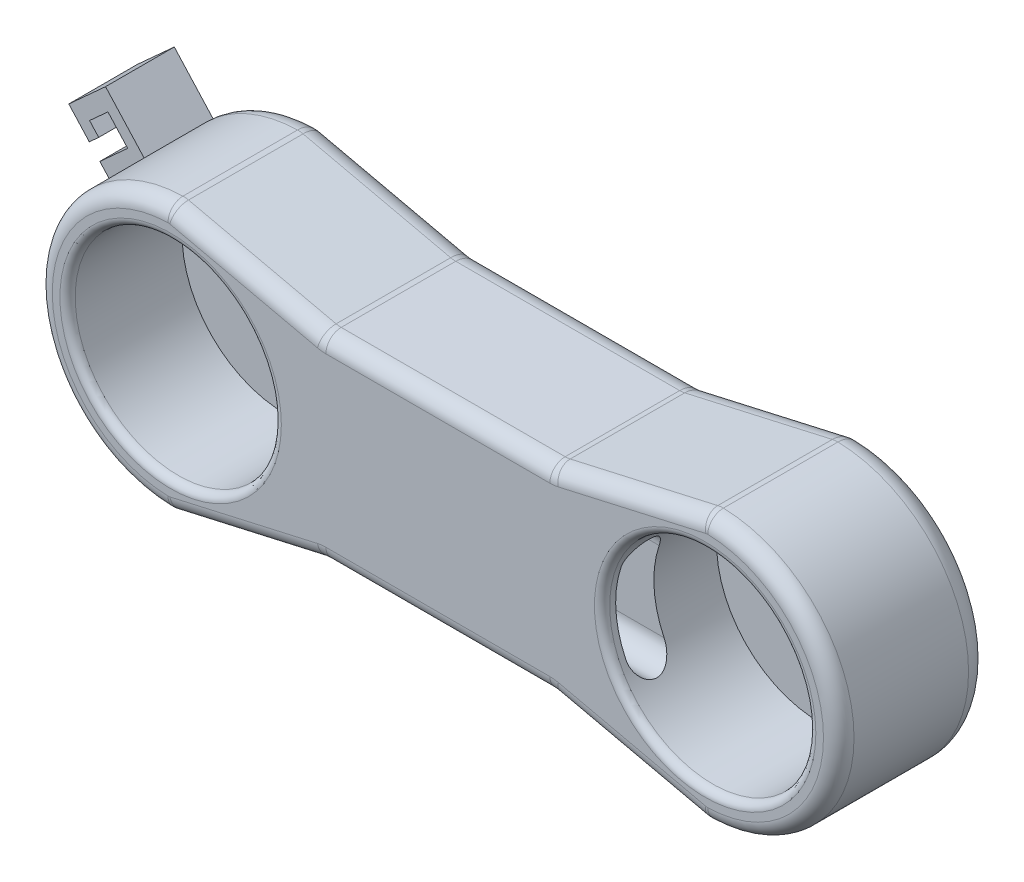
from build123d import *

# Parameters (mm, degrees)
BOSS_EXTRUDE2_DEPTH             = 20
SKETCH12_R                      = 13.5
SKETCH12_R_2                    = 13.500000000000002
CUT_EXTRUDE3_DEPTH              = 15
SKETCH13_R                      = 0.889
SKETCH13_R_2                    = 0.533499999999999
CUT_EXTRUDE4_DEPTH              = 91.48480535426931
SKETCH14_R                      = 0.8890000000000032
SKETCH14_R_2                    = 0.5335000000000029
SKETCH14_R_3                    = 0.5335000000000094
CUT_EXTRUDE5_DEPTH              = 91.48480535426931
FILLET2_R                       = 3
CUT_EXTRUDE8_DEPTH              = 63.00000000000004
FILLET3_R                       = 1
BOSS_EXTRUDE3_REACH             = 107.737
BOSS_EXTRUDE3_END_RADIUS        = 17.500000000000004
SKETCH19_W                      = 9.002102243584886
SKETCH19_H                      = 6.500944555170919
BOSS_EXTRUDE3_DIRECTION_2_DEPTH = 7.5
CUT_EXTRUDE9_DEPTH              = 91.02287753534617
CUT_EXTRUDE9_DEPTH_BACK         = 91.02287753534617
FILLET9_R                       = 2
FILLET11_R                      = 3


with BuildPart() as part:
    # Sketch10 → Boss-Extrude2 (new body)
    with BuildSketch(Plane.XY):
        with BuildLine():
            ThreePointArc((0, 17.500000000000004), (-17.500000000000004, 1.07e-15), (-2.14e-15, -17.500000000000004))
            Line((0, -17.5), (20.000000000000004, -12.967243251438873))
            Line((20.000000000000004, -12.967243251438873), (50, -12.967243251438873))
            Line((50, -12.967243251438873), (70, -17.5))
            ThreePointArc((70, -17.50000000000002), (87.50000000000003, -1.07e-15), (70, 17.50000000000002))
            Line((70, 17.5), (50, 12.967243251438873))
            Line((50, 12.967243251438873), (20.000000000000004, 12.967243251438873))
            Line((20.000000000000004, 12.967243251438873), (0, 17.5))
        make_face()
    extrude(amount=BOSS_EXTRUDE2_DEPTH)

    # Sketch12 → Cut-Extrude3 (cut)
    with BuildSketch(Plane.XY.offset(20)):
        Circle(SKETCH12_R)
        with Locations((70, 0)):
            Circle(SKETCH12_R_2)
    extrude(amount=-CUT_EXTRUDE3_DEPTH, mode=Mode.SUBTRACT)

    # Sketch13 → Cut-Extrude4 (cut, through all)
    with BuildSketch(Plane.XY.offset(5.000000000000001)):
        Circle(SKETCH13_R)
        with Locations((-8.306, 0)):
            Circle(SKETCH13_R_2)
        with Locations(Location((8.306000000000003, 2.03e-15, 0), (0, 0, 180))):
            Circle(SKETCH13_R_2)
    extrude(amount=-CUT_EXTRUDE4_DEPTH, mode=Mode.SUBTRACT)

    # Sketch14 → Cut-Extrude5 (cut, through all)
    with BuildSketch(Plane.XY.offset(5.000000000000001)):
        with Locations((70, 0)):
            Circle(SKETCH14_R)
        with Locations((78.306, -6.5e-16)):
            Circle(SKETCH14_R_2)
        with Locations(Location((61.69400000000001, -2.69e-15, 0), (0, 0, 180))):
            Circle(SKETCH14_R_3)
    extrude(amount=-CUT_EXTRUDE5_DEPTH, mode=Mode.SUBTRACT)

    # Fillet2
    fillet2_edges = [part.edges().sort_by_distance(p)[0] for p in [
        (20.000000000000004, -12.967243251438873, 10),
        (-3.18e-15, -17.5, 10),
        (0, 17.5, 10),
        (20.000000000000004, 12.967243251438873, 10),
        (50, 12.967243251438873, 10),
        (70, 17.500000000000014, 10),
        (70, -17.500000000000014, 10),
        (50, -12.967243251438873, 10),
    ]]
    fillet(fillet2_edges, radius=FILLET2_R)

    # Sketch17 → Cut-Extrude8 (cut)
    with BuildSketch(Plane(origin=(10, 0, 0), x_dir=(0, 0, -1), z_dir=(1, 0, 0))):
        with BuildLine():
            Line((-18.219165985751065, -5.866772091514335), (-18.21916598575106, 4.2723857354989))
            ThreePointArc((-18.21916598575106, 4.2723857354989), (-15.719165985751069, 6.772385735498896), (-13.219165985751072, 4.2723857354989))
            Line((-13.219165985751072, 4.2723857354989), (-13.219165985751069, -5.866772091514335))
            ThreePointArc((-13.219165985751069, -5.866772091514335), (-15.719165985751069, -8.366772091514331), (-18.219165985751065, -5.866772091514335))
        make_face()
    extrude(amount=CUT_EXTRUDE8_DEPTH, mode=Mode.SUBTRACT)

    # Fillet3
    fillet3_edges = [part.edges().sort_by_distance(p)[0] for p in [
        (-13.5, 1.65e-15, 20),
        (56.5, 1.65e-15, 20),
    ]]
    fillet(fillet3_edges, radius=FILLET3_R)

    # Boss-Extrude3: up to this cylinder (the profile starts outside it)
    boss_extrude3_end = Plane(origin=(0, 0, 6.645664), z_dir=(0, 0, -1)) * Cylinder(BOSS_EXTRUDE3_END_RADIUS, 251.474, mode=Mode.PRIVATE)
    # Sketch19 → Boss-Extrude3 (add, up to the surface)
    with BuildSketch(Plane(origin=(-11.761970975540276, 12.9578562567482, 0), x_dir=(0, 0, -1), z_dir=(-0.6721126271737297, 0.7404489289570396, 0)), mode=Mode.PRIVATE) as boss_extrude3_sk1:
        with Locations((-6.645664050040523, 4.026835519852057)):
            Rectangle(SKETCH19_W, SKETCH19_H)
    boss_extrude3_tool1 = extrude(boss_extrude3_sk1.sketch, amount=-BOSS_EXTRUDE3_REACH, mode=Mode.PRIVATE) - boss_extrude3_end
    add(boss_extrude3_tool1.solids().sort_by_distance((-14.743637, 10.251369, 6.645664))[0])

    # Sketch19 → Boss-Extrude3 direction 2 (add)
    with BuildSketch(Plane(origin=(-11.761970975540276, 12.9578562567482, 0), x_dir=(0, 0, -1), z_dir=(-0.6721126271737297, 0.7404489289570396, 0))):
        with Locations((-6.645664050040523, 4.026835519852057)):
            Rectangle(SKETCH19_W, SKETCH19_H)
    extrude(amount=BOSS_EXTRUDE3_DIRECTION_2_DEPTH)

    # Sketch21 → Cut-Extrude9 (cut, two sides: drawn at the far end of the back side and taken through both)
    with BuildSketch(Plane.XY.offset(11.146715171832966).offset(-CUT_EXTRUDE9_DEPTH_BACK)):
        Polygon((-19.508753299581933, 10.664771644994326), (-18.27524674807696, 11.784437426854238), (-19.471024426071118, 13.101794466647876), (-17.06283639674614, 15.287729944193623), (-14.480752862896878, 12.443115946751053), (-18.122447443726838, 9.1375146873454), align=None)
    extrude(amount=CUT_EXTRUDE9_DEPTH + CUT_EXTRUDE9_DEPTH_BACK, mode=Mode.SUBTRACT)

    # Fillet9
    fillet9_edges = [part.edges().sort_by_distance(p)[0] for p in [
        (49.99791778292249, 12.985851092176992, 20),
        (20.00208221707747, 12.985851092176995, 20),
        (87.50000000000003, -1.07e-15, 20),
        (59.99220377741234, -15.231854706692062, 20),
        (35.00000000000002, -12.967243251438873, 20),
        (59.99220377741232, 15.231854706692058, 20),
        (34.99999999999998, 12.967243251438873, 20),
        (10.0077962225877, 15.231854706692053, 20),
        (-17.5, -7e-16, 20),
        (10.007796222587723, -15.231854706692047, 20),
        (-0.01942127728087611, 17.48135942497659, 20),
        (70.01942127728097, 17.481359424976606, 20),
        (-0.01942127728087728, -17.48135942497659, 20),
        (70.01942127728098, -17.48135942497661, 20),
        (49.997917782922535, -12.985851092176995, 20),
        (20.002082217077515, -12.985851092176992, 20),
    ]]
    fillet(fillet9_edges, radius=FILLET9_R)

    # Fillet11
    # the kernel refuses this fillet: 3 mm, written as the material it takes off along each edge
    with BuildSketch(Plane(origin=(20.335699951455897, 15.967243251438873, 0), x_dir=(0, -1, 0), z_dir=(1, 0, 0))) as fillet11_piece_1:
        with BuildLine():
            CenterArc((3 + FILLET11_R, -FILLET11_R), FILLET11_R, 90, 90)
            Line((3 + FILLET11_R, 4.4e-16), (3, 0))
            Line((3, 0), (3, -FILLET11_R))
        make_face()
    revolve(axis=Axis((20.335699951455897, 15.967243251438873, 0), (0, 0, -1)), revolution_arc=12.769671479797836, mode=Mode.SUBTRACT)
    with BuildSketch(Plane(origin=(19.672603086478194, 13.041443779900076, 0), x_dir=(0, 0, 1), z_dir=(-0.9752664905129345, 0.22103228832590147, 0))) as fillet11_piece_2:
        with BuildLine():
            CenterArc((FILLET11_R, -FILLET11_R), FILLET11_R, 90, 90)
            Line((-4.4e-16, -FILLET11_R), (0, 0))
            Line((0, 0), (FILLET11_R, 0))
        make_face()
    extrude(amount=19.81982762230938, mode=Mode.SUBTRACT)
    with BuildSketch(Plane(origin=(-0.32010750628049367, 14.496466161945229, 0), x_dir=(0.22103228832590088, 0.9752664905129346, 0), z_dir=(0.9752664905129346, -0.22103228832590088, 0))) as fillet11_piece_3:
        with BuildLine():
            CenterArc((2.9999999999999987 - FILLET11_R, FILLET11_R), FILLET11_R, 270, 90)
            Line((2.9999999999999987 - FILLET11_R, -4.4e-16), (2.9999999999999987, 0))
            Line((2.9999999999999987, 0), (2.999999999999999, FILLET11_R))
        make_face()
    revolve(axis=Axis((-0.32010750628049367, 14.496466161945229, 0), (0, 0, 1)), revolution_arc=14.03465763220754, mode=Mode.SUBTRACT)
    with BuildSketch(Plane(origin=(1.78e-15, 0, 0), x_dir=(-0.022076379743482318, 0.9997562870307052, 0), z_dir=(0.9997562870307052, 0.022076379743482318, 0))) as fillet11_piece_4_section:
        with BuildLine():
            CenterArc((17.500000000000004 - FILLET11_R, FILLET11_R), FILLET11_R, 270, 90)
            Line((17.500000000000004 - FILLET11_R, -4.4e-16), (17.500000000000004, 0))
            Line((17.500000000000004, 0), (17.500000000000004, FILLET11_R))
        make_face()
    fillet11_piece_4 = revolve(axis=Axis((1.78e-15, 0, 0), (0, 0, 1)), revolution_arc=177.4700276951803, mode=Mode.PRIVATE)
    fillet11_piece_4 = split(fillet11_piece_4, bisect_by=Plane(origin=(-6.837512008717816, 16.0862166267895, 2.1446129282480797), z_dir=(0, 0, 1)), keep=Keep.TOP, mode=Mode.PRIVATE)
    fillet11_piece_4 = split(fillet11_piece_4, bisect_by=Plane(origin=(-11.669151644289231, 11.700490775859087, 2.5662882283798063), z_dir=(0.7404489289570396, 0.6721126271737297, 0)), keep=Keep.TOP, mode=Mode.PRIVATE)
    add(fillet11_piece_4, mode=Mode.SUBTRACT)
    with BuildSketch(Plane(origin=(1.78e-15, 0, 0), x_dir=(-0.022076379743482318, 0.9997562870307052, 0), z_dir=(0.9997562870307052, 0.022076379743482318, 0))) as fillet11_piece_5_section:
        with BuildLine():
            CenterArc((17.500000000000004 - FILLET11_R, FILLET11_R), FILLET11_R, 270, 90)
            Line((17.500000000000004 - FILLET11_R, -4.4e-16), (17.500000000000004, 0))
            Line((17.500000000000004, 0), (17.500000000000004, FILLET11_R))
        make_face()
    fillet11_piece_5 = revolve(axis=Axis((1.78e-15, 0, 0), (0, 0, 1)), revolution_arc=177.4700276951803, mode=Mode.PRIVATE)
    fillet11_piece_5 = split(fillet11_piece_5, bisect_by=Plane(origin=(-6.432198189279362, 15.101517940954933, 2.1446129282480797), z_dir=(0, 0, -1)), keep=Keep.TOP, mode=Mode.PRIVATE)
    fillet11_piece_5 = split(fillet11_piece_5, bisect_by=Plane(origin=(-10.996006905315603, 10.958904796285973, 0.6199816632256723), z_dir=(0.7404489289570396, 0.6721126271737297, 0)), keep=Keep.TOP, mode=Mode.PRIVATE)
    add(fillet11_piece_5, mode=Mode.SUBTRACT)
    with BuildSketch(Plane(origin=(1.78e-15, 0, 0), x_dir=(-0.022076379743482318, 0.9997562870307052, 0), z_dir=(0.9997562870307052, 0.022076379743482318, 0))) as fillet11_piece_6_section:
        with BuildLine():
            CenterArc((17.500000000000004 - FILLET11_R, FILLET11_R), FILLET11_R, 270, 90)
            Line((17.500000000000004 - FILLET11_R, -4.4e-16), (17.500000000000004, 0))
            Line((17.500000000000004, 0), (17.500000000000004, FILLET11_R))
        make_face()
    fillet11_piece_6 = revolve(axis=Axis((1.78e-15, 0, 0), (0, 0, 1)), revolution_arc=177.4700276951803, mode=Mode.PRIVATE)
    fillet11_piece_6 = split(fillet11_piece_6, bisect_by=Plane(origin=(-16.256928066393282, 7.082320707872399, 0.6073763093884104), z_dir=(0.7404489289570396, 0.6721126271737297, 0)), keep=Keep.TOP, mode=Mode.PRIVATE)
    fillet11_piece_6 = split(fillet11_piece_6, bisect_by=Plane(origin=(-13.8911757197956, 9.229736907331091, 2.1446129282480797), z_dir=(0, 0, -1)), keep=Keep.TOP, mode=Mode.PRIVATE)
    fillet11_piece_6 = split(fillet11_piece_6, bisect_by=Plane(origin=(-11.443310633307878, 11.451687631959079, 0.6073763093884099), z_dir=(-0.7404489289570396, -0.6721126271737297, 0)), keep=Keep.TOP, mode=Mode.PRIVATE)
    add(fillet11_piece_6, mode=Mode.SUBTRACT)
    with BuildSketch(Plane(origin=(1.78e-15, 0, 0), x_dir=(-0.022076379743482318, 0.9997562870307052, 0), z_dir=(0.9997562870307052, 0.022076379743482318, 0))) as fillet11_piece_7_section:
        with BuildLine():
            CenterArc((17.500000000000004 - FILLET11_R, FILLET11_R), FILLET11_R, 270, 90)
            Line((17.500000000000004 - FILLET11_R, -4.4e-16), (17.500000000000004, 0))
            Line((17.500000000000004, 0), (17.500000000000004, FILLET11_R))
        make_face()
    fillet11_piece_7 = revolve(axis=Axis((1.78e-15, 0, 0), (0, 0, 1)), revolution_arc=177.4700276951803, mode=Mode.PRIVATE)
    fillet11_piece_7 = split(fillet11_piece_7, bisect_by=Plane(origin=(-7.320045882534297, -2.7632090050267077, 2.565729406664275), z_dir=(-0.7404489289570396, -0.6721126271737297, 0)), keep=Keep.TOP, mode=Mode.PRIVATE)
    fillet11_piece_7 = split(fillet11_piece_7, bisect_by=Plane(origin=(-14.700675871675383, -9.462677959875641, 2.1446129282480797), z_dir=(0, 0, 1)), keep=Keep.TOP, mode=Mode.PRIVATE)
    add(fillet11_piece_7, mode=Mode.SUBTRACT)
    with BuildSketch(Plane(origin=(1.78e-15, 0, 0), x_dir=(-0.022076379743482318, 0.9997562870307052, 0), z_dir=(0.9997562870307052, 0.022076379743482318, 0))) as fillet11_piece_8_section:
        with BuildLine():
            CenterArc((17.500000000000004 - FILLET11_R, FILLET11_R), FILLET11_R, 270, 90)
            Line((17.500000000000004 - FILLET11_R, -4.4e-16), (17.500000000000004, 0))
            Line((17.500000000000004, 0), (17.500000000000004, FILLET11_R))
        make_face()
    fillet11_piece_8 = revolve(axis=Axis((1.78e-15, 0, 0), (0, 0, 1)), revolution_arc=177.4700276951803, mode=Mode.PRIVATE)
    fillet11_piece_8 = split(fillet11_piece_8, bisect_by=Plane(origin=(-7.173645641389987, -2.9244943274141075, 0.5618888728889413), z_dir=(-0.7404489289570396, -0.6721126271737297, 0)), keep=Keep.TOP, mode=Mode.PRIVATE)
    fillet11_piece_8 = split(fillet11_piece_8, bisect_by=Plane(origin=(-13.706999923478332, -8.854882959316505, 2.1446129282480797), z_dir=(0, 0, -1)), keep=Keep.TOP, mode=Mode.PRIVATE)
    add(fillet11_piece_8, mode=Mode.SUBTRACT)
    with BuildSketch(Plane(origin=(-0.32010750628049367, -14.496466161945229, 0), x_dir=(-0.022076379743483195, -0.9997562870307051, 0), z_dir=(-0.9997562870307051, 0.022076379743483195, 0))) as fillet11_piece_9:
        with BuildLine():
            CenterArc((3.0000000000000004 - FILLET11_R, FILLET11_R), FILLET11_R, 270, 90)
            Line((3.0000000000000004 - FILLET11_R, -4.4e-16), (3.0000000000000004, 0))
            Line((3.0000000000000004, 0), (3.0000000000000004, FILLET11_R))
        make_face()
    revolve(axis=Axis((-0.32010750628049367, -14.496466161945229, 0), (0, 0, 1)), revolution_arc=14.034657632207667, mode=Mode.SUBTRACT)
    with BuildSketch(Plane(origin=(0.34298935869720953, -17.422265633484027, 0), x_dir=(1e-17, -5e-17, 1), z_dir=(0.9752664905129345, 0.22103228832590147, 0))) as fillet11_piece_10:
        with BuildLine():
            CenterArc((FILLET11_R, -FILLET11_R), FILLET11_R, 90, 90)
            Line((-5.9e-16, -FILLET11_R), (0, 0))
            Line((0, 0), (FILLET11_R, 0))
        make_face()
    extrude(amount=19.81982762230942, mode=Mode.SUBTRACT)
    with BuildSketch(Plane(origin=(20.33569995145594, -15.96724325143887, 0), x_dir=(0, 1, 0), z_dir=(1, 0, 0))) as fillet11_piece_11:
        with BuildLine():
            CenterArc((3 + FILLET11_R, FILLET11_R), FILLET11_R, 180, 90)
            Line((3 + FILLET11_R, -4.4e-16), (3, 0))
            Line((3, 0), (3, FILLET11_R))
        make_face()
    revolve(axis=Axis((20.33569995145594, -15.96724325143887, 0), (0, 0, 1)), revolution_arc=12.76967147979776, mode=Mode.SUBTRACT)
    with BuildSketch(Plane(origin=(20.33569995145594, -12.967243251438873, 0), x_dir=(0, 0, 1), z_dir=(1, 0, 0)), Plane(origin=(49.664300048544064, 12.967243251438873, 0), x_dir=(0, 0, 1), z_dir=(-1, 0, 0))) as fillet11_piece_12:
        with BuildLine():
            CenterArc((FILLET11_R, -FILLET11_R), FILLET11_R, 90, 90)
            Line((-4.4e-16, -FILLET11_R), (0, 0))
            Line((0, 0), (FILLET11_R, 0))
        make_face()
    extrude(amount=29.328600097088167, mode=Mode.SUBTRACT)
    with BuildSketch(Plane(origin=(49.664300048544106, -15.967243251438873, 0), x_dir=(0.22103228832590116, 0.9752664905129346, 0), z_dir=(0.9752664905129346, -0.22103228832590116, 0))) as fillet11_piece_13:
        with BuildLine():
            CenterArc((2.999999999999999 + FILLET11_R, FILLET11_R), FILLET11_R, 180, 89.99999999999994)
            Line((2.999999999999999 + FILLET11_R, -4.4e-16), (2.999999999999999, 0))
            Line((2.999999999999999, 0), (3.000000000000001, FILLET11_R))
        make_face()
    revolve(axis=Axis((49.664300048544106, -15.967243251438873, 0), (0, 0, 1)), revolution_arc=12.769671479797784, mode=Mode.SUBTRACT)
    with BuildSketch(Plane(origin=(50.32739691352181, -13.041443779900076, 0), x_dir=(-1.4e-16, -6.2e-16, 1), z_dir=(0.9752664905129345, -0.2210322883259015, 0))) as fillet11_piece_14:
        with BuildLine():
            CenterArc((FILLET11_R, -FILLET11_R), FILLET11_R, 89.99999999999997, 90)
            Line((-2.34e-15, -FILLET11_R), (0, 0))
            Line((0, 0), (FILLET11_R, 0))
        make_face()
    extrude(amount=19.81982762230946, mode=Mode.SUBTRACT)
    with BuildSketch(Plane(origin=(70.32010750628058, -14.496466161945248, 0), x_dir=(0.022076379743490793, -0.999756287030705, 0), z_dir=(0.999756287030705, 0.022076379743490793, 0))) as fillet11_piece_15:
        with BuildLine():
            CenterArc((2.9999999999999996 - FILLET11_R, -FILLET11_R), FILLET11_R, 0, 89.99999999999997)
            Line((2.9999999999999996 - FILLET11_R, 4.4e-16), (2.9999999999999996, 0))
            Line((2.9999999999999996, 0), (2.9999999999999996, -FILLET11_R))
        make_face()
    revolve(axis=Axis((70.32010750628058, -14.496466161945248, 0), (0, 0, -1)), revolution_arc=14.034657632208075, mode=Mode.SUBTRACT)
    with BuildSketch(Plane(origin=(70, 0, 0), x_dir=(0.022076379743487775, -0.999756287030705, 0), z_dir=(-0.999756287030705, -0.022076379743487775, 0))) as fillet11_piece_16:
        with BuildLine():
            CenterArc((17.500000000000025 - FILLET11_R, FILLET11_R), FILLET11_R, 270, 90)
            Line((17.500000000000025 - FILLET11_R, -4.4e-16), (17.500000000000025, 0))
            Line((17.500000000000025, 0), (17.500000000000025, FILLET11_R))
        make_face()
    revolve(axis=Axis((70, 0, 0), (0, 0, 1)), revolution_arc=177.47002769517965, mode=Mode.SUBTRACT)
    with BuildSketch(Plane(origin=(70.32010750628058, 14.496466161945248, 0), x_dir=(-0.22103228832590102, 0.9752664905129346, 0), z_dir=(-0.9752664905129346, -0.22103228832590102, 0))) as fillet11_piece_17:
        with BuildLine():
            CenterArc((3.000000000000001 - FILLET11_R, -FILLET11_R), FILLET11_R, 0, 90)
            Line((3.000000000000001 - FILLET11_R, 4.4e-16), (3.000000000000001, 0))
            Line((3.000000000000001, 0), (3.000000000000001, -FILLET11_R))
        make_face()
    revolve(axis=Axis((70.32010750628058, 14.496466161945248, 0), (0, 0, -1)), revolution_arc=14.03465763220782, mode=Mode.SUBTRACT)
    with BuildSketch(Plane(origin=(69.65701064130288, 17.42226563348405, 0), x_dir=(0, 0, 1), z_dir=(-0.9752664905129345, -0.2210322883259015, 0))) as fillet11_piece_18:
        with BuildLine():
            CenterArc((FILLET11_R, -FILLET11_R), FILLET11_R, 90, 90)
            Line((-4.4e-16, -FILLET11_R), (0, 0))
            Line((0, 0), (FILLET11_R, 0))
        make_face()
    extrude(amount=19.819827622309507, mode=Mode.SUBTRACT)
    with BuildSketch(Plane(origin=(49.664300048544064, 15.96724325143887, 0), x_dir=(0.22103228832590116, -0.9752664905129346, 0), z_dir=(0.9752664905129346, 0.22103228832590116, 0))) as fillet11_piece_19:
        with BuildLine():
            CenterArc((2.999999999999999 + FILLET11_R, -FILLET11_R), FILLET11_R, 90.00000000000004, 89.99999999999994)
            Line((2.999999999999999 + FILLET11_R, 4.4e-16), (2.999999999999999, 0))
            Line((2.999999999999999, 0), (3.000000000000001, -FILLET11_R))
        make_face()
    revolve(axis=Axis((49.664300048544064, 15.96724325143887, 0), (0, 0, -1)), revolution_arc=12.769671479797784, mode=Mode.SUBTRACT)


solid = part.part
